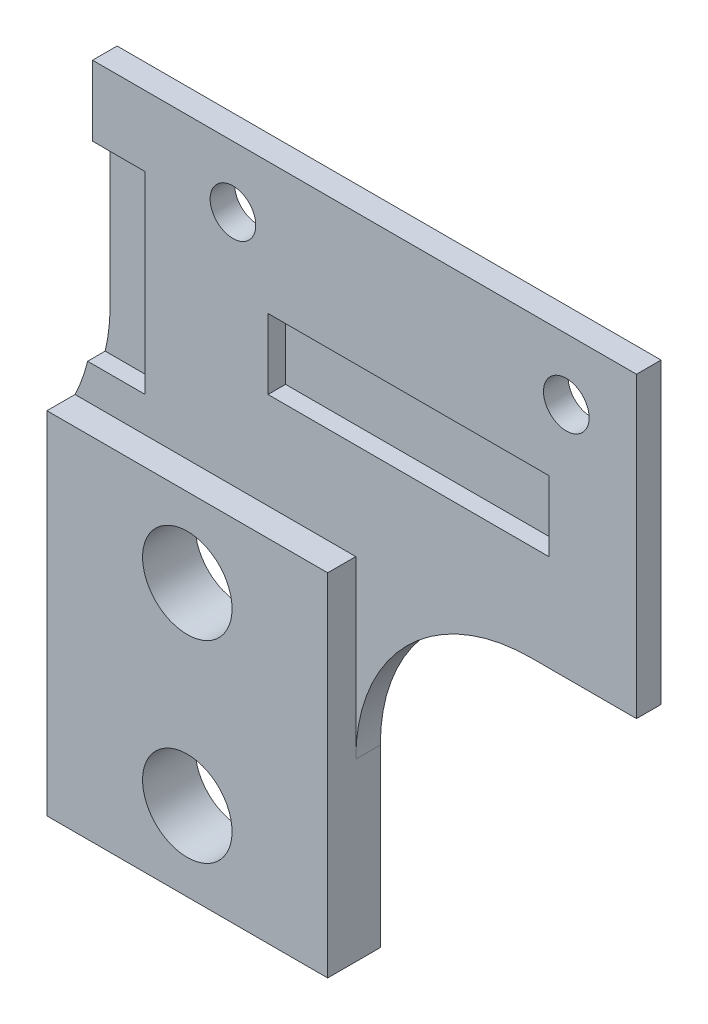
from build123d import *

# Parameters (mm, degrees)
SKETCH1_W           = 40
SKETCH1_H           = 17
BOSS_EXTRUDE1_DEPTH = 1.4
CUT_EXTRUDE1_START  = 1.4
SKETCH3_W           = 16
SKETCH3_H           = 4
SKETCH3_W_2         = 3
SKETCH3_H_2         = 11
CUT_EXTRUDE1_DEPTH  = 1
SKETCH4_R           = 1.3
CUT_EXTRUDE2_DEPTH  = 11
SKETCH7_W           = 9
SKETCH7_H           = 17
CUT_EXTRUDE5_DEPTH  = 21
SKETCH9_R           = 2.55
BOSS_EXTRUDE3_DEPTH = 3
FILLET2_R           = 10


with BuildPart() as part:
    # Sketch1 → Boss-Extrude1 (new body)
    with BuildSketch(Plane.XY):
        Rectangle(SKETCH1_W, SKETCH1_H)
    extrude(amount=BOSS_EXTRUDE1_DEPTH)

    # Sketch3 → Cut-Extrude1 (cut)
    with BuildSketch(Plane.XY.offset(CUT_EXTRUDE1_START)):
        with Locations((7, -1)):
            Rectangle(SKETCH3_W, SKETCH3_H)
        with Locations((-9.5, -1)):
            Rectangle(SKETCH3_W_2, SKETCH3_H_2)
    extrude(amount=-CUT_EXTRUDE1_DEPTH, mode=Mode.SUBTRACT)

    # Sketch4 → Cut-Extrude2 (cut)
    with BuildSketch(Plane.XY):
        with Locations(Location((16, 5, 0), (0, 0, 180))):
            Circle(SKETCH4_R)
        with Locations(Location((-3, 5, 0), (0, 0, 180))):
            Circle(SKETCH4_R)
    extrude(amount=CUT_EXTRUDE2_DEPTH, mode=Mode.SUBTRACT)

    # Sketch7 → Cut-Extrude5 (cut)
    with BuildSketch(Plane.XY):
        with Locations((-15.5, 0)):
            Rectangle(SKETCH7_W, SKETCH7_H)
    extrude(amount=CUT_EXTRUDE5_DEPTH, mode=Mode.SUBTRACT)

    # Sketch9 → Boss-Extrude3 (add)
    with BuildSketch(Plane.XY):
        Polygon((-12, -8.5), (-12, -28.5), (4, -28.5), (4, -8.5), (-4, -8.5), align=None)
        with Locations((-4, -13)):
            Circle(SKETCH9_R, mode=Mode.SUBTRACT)
        with Locations((-4, -24)):
            Circle(SKETCH9_R, mode=Mode.SUBTRACT)
    extrude(amount=BOSS_EXTRUDE3_DEPTH)

    # Fillet2
    # the kernel refuses this fillet: 10 mm, written as the material it adds along each edge
    with BuildSketch(Plane(origin=(-11, -8.5, 0), x_dir=(0, 1, 0), z_dir=(0, 0, 1))) as fillet2_piece_1_section:
        with BuildLine():
            CenterArc((4.358898944, 10), FILLET2_R, 244.158067237, 25.841932763)
            Line((0, 1), (0, 0))
            Line((0, 0), (4.358898944, 0))
        make_face()
    fillet2_piece_1 = extrude(amount=12.297247359, mode=Mode.PRIVATE)
    fillet2_piece_1 = split(fillet2_piece_1, bisect_by=Plane(origin=(-11, -8.5, 0.4), z_dir=(0, 0, -1)), keep=Keep.TOP, mode=Mode.PRIVATE)
    add(fillet2_piece_1)
    with BuildSketch(Plane(origin=(-11, -8.5, -10.897247359), x_dir=(0, 1, 0), z_dir=(0, 0, 1))) as fillet2_piece_2_section:
        with BuildLine():
            CenterArc((4.358898944, 10), FILLET2_R, 244.158067237, 25.841932763)
            Line((0, 1), (0, 0))
            Line((0, 0), (4.358898944, 0))
        make_face()
    fillet2_piece_2 = extrude(amount=12.297247359, mode=Mode.PRIVATE)
    fillet2_piece_2 = split(fillet2_piece_2, bisect_by=Plane(origin=(-11, -6.5, -10.897247359), z_dir=(0, -1, 0)), keep=Keep.TOP, mode=Mode.PRIVATE)
    fillet2_piece_2 = split(fillet2_piece_2, bisect_by=Plane(origin=(-11, -8.5, 0.4), z_dir=(0, 0, 1)), keep=Keep.TOP, mode=Mode.PRIVATE)
    add(fillet2_piece_2)
    with BuildSketch(Plane(origin=(4, -8.5, 0), x_dir=(1, 0, 0), z_dir=(0, 0, 1))) as fillet2_piece_3:
        with BuildLine():
            CenterArc((FILLET2_R, -FILLET2_R), FILLET2_R, 90, 90)
            Line((0, -FILLET2_R), (0, 0))
            Line((0, 0), (FILLET2_R, 0))
        make_face()
    extrude(amount=1.4)


solid = part.part
